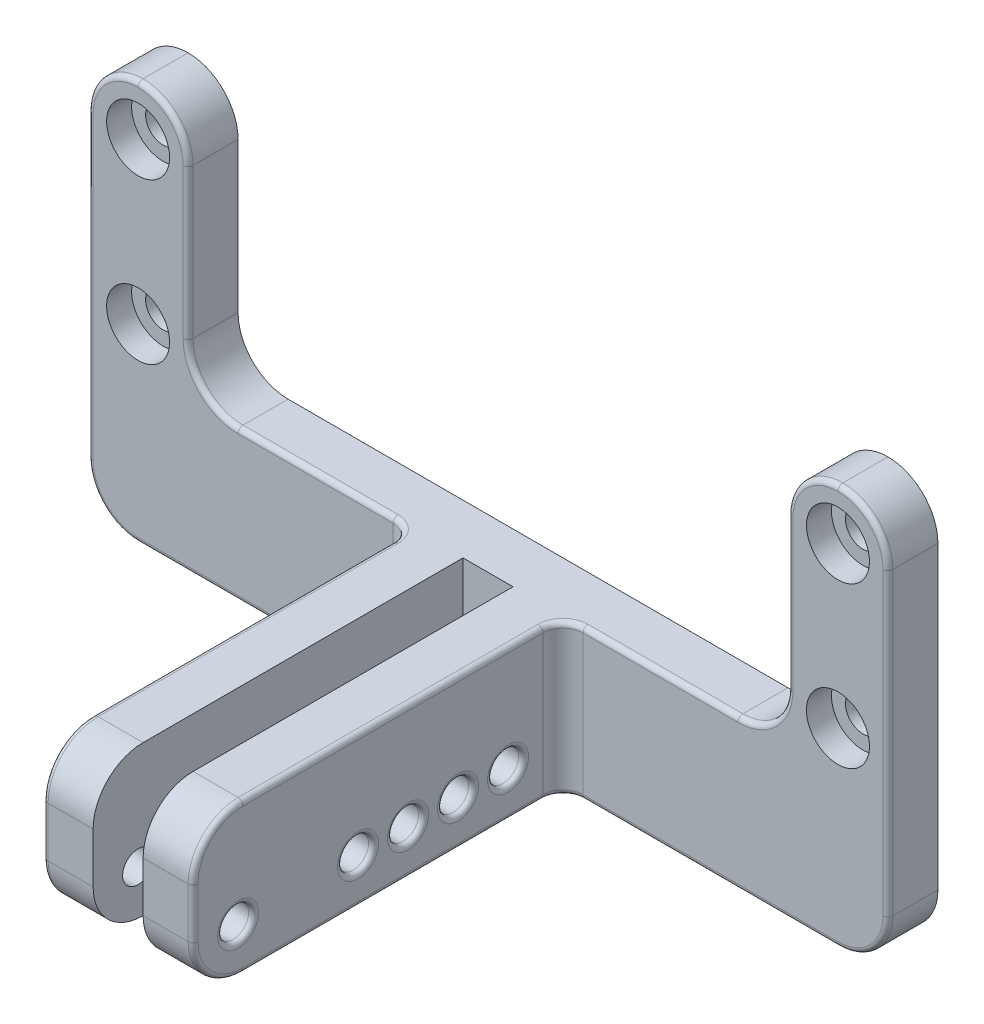
from build123d import *

# Parameters (mm, degrees)
SKETCH_1_W          = 80
SKETCH_1_H          = 40
EXTRUDE_1_DEPTH     = 5
SKETCH_2_R          = 1.75
CUT_EXTRUDE_1_DEPTH = 46
SKETCH_3_W          = 5
SKETCH_3_H          = 15
EXTRUDE_2_DEPTH     = 37
SKETCH_4_R          = 1.55
CUT_EXTRUDE_2_DEPTH = 67.484960705
SKETCH_5_W          = 60
SKETCH_5_H          = 25
CUT_EXTRUDE_3_DEPTH = 5
FILLET_1_R          = 5
FILLET_2_R          = 5
FILLET_3_R          = 2
FILLET_4_R          = 0.5
SKETCH_6_R          = 3.15
CUT_EXTRUDE_4_DEPTH = 2.5


with BuildPart() as part:
    # ｽｹｯﾁ1 → ﾎﾞｽ - 押し出し1 (new body)
    with BuildSketch(Plane.XY):
        Rectangle(SKETCH_1_W, SKETCH_1_H)
    extrude(amount=EXTRUDE_1_DEPTH)

    # ｽｹｯﾁ2 → ｶｯﾄ - 押し出し1 (cut, through all)
    with BuildSketch(Plane.XY):
        with Locations((35, 15)):
            Circle(SKETCH_2_R)
        with Locations((35, -1)):
            Circle(SKETCH_2_R)
        with Locations(Location((-35, 15, 0), (0, 0, 180))):
            Circle(SKETCH_2_R)
        with Locations(Location((-35, -1, 0), (0, 0, 180))):
            Circle(SKETCH_2_R)
    extrude(amount=CUT_EXTRUDE_1_DEPTH, mode=Mode.SUBTRACT)

    # ｽｹｯﾁ3 → ﾎﾞｽ - 押し出し2 (add)
    with BuildSketch(Plane.XY.offset(5)):
        with Locations((5, -12.5)):
            Rectangle(SKETCH_3_W, SKETCH_3_H)
        with Locations((-5, -12.5)):
            Rectangle(SKETCH_3_W, SKETCH_3_H)
    extrude(amount=EXTRUDE_2_DEPTH)

    # ｽｹｯﾁ4 → ｶｯﾄ - 押し出し2 (cut, through all)
    with BuildSketch(Plane.ZY.offset(7.5)):
        with Locations(Location((10.5, -15.5, 0), (0, 0, 90))):
            Circle(SKETCH_4_R)
        with Locations(Location((37.5, -15.5, 0), (0, 0, 90))):
            Circle(SKETCH_4_R)
        with Locations(Location((15.5, -15.5, 0), (0, 0, 90))):
            Circle(SKETCH_4_R)
        with Locations(Location((20.5, -15.5, 0), (0, 0, 90))):
            Circle(SKETCH_4_R)
        with Locations(Location((25.5, -15.5, 0), (0, 0, 90))):
            Circle(SKETCH_4_R)
    extrude(amount=-CUT_EXTRUDE_2_DEPTH, mode=Mode.SUBTRACT)

    # ｽｹｯﾁ5 → ｶｯﾄ - 押し出し3 (cut)
    with BuildSketch(Plane.XY):
        with Locations((0, 7.5)):
            Rectangle(SKETCH_5_W, SKETCH_5_H)
    extrude(amount=CUT_EXTRUDE_3_DEPTH, mode=Mode.SUBTRACT)

    # ﾌｨﾚｯﾄ1
    fillet_1_edges = [part.edges().sort_by_distance(p)[0] for p in [
        (5, -5, 42),
        (-5, -5, 42),
        (5, -20, 42),
        (-5, -20, 42),
    ]]
    fillet(fillet_1_edges, radius=FILLET_1_R)

    # ﾌｨﾚｯﾄ2
    fillet_2_edges = [part.edges().sort_by_distance(p)[0] for p in [
        (-30, -5, 2.5),
        (30, -5, 2.5),
        (30, 20, 2.5),
        (40, 20, 2.5),
        (40, -20, 2.5),
        (-40, -20, 2.5),
        (-30, 20, 2.5),
        (-40, 20, 2.5),
    ]]
    fillet(fillet_2_edges, radius=FILLET_2_R - 0.0001)  # a hair under: the kernel refuses the full size

    # ﾌｨﾚｯﾄ3
    fillet_3_edges = [part.edges().sort_by_distance(p)[0] for p in [
        (7.5, -12.5, 5),
        (-7.5, -12.5, 5),
    ]]
    fillet(fillet_3_edges, radius=FILLET_3_R)

    # ﾌｨﾚｯﾄ4
    fillet_4_edges = [part.edges().sort_by_distance(p)[0] for p in [
        (7.5, -12.5, 42),
        (7.5, -5, 22),
        (-7.5, -5, 22),
        (7.5, -20, 22),
        (7.5, -18.535533906, 40.535533906),
        (7.5, -6.464466094, 40.535533906),
        (-7.5, -12.5, 42),
        (-7.5, -20, 22),
        (-7.5, -18.535533906, 40.535533906),
        (-7.5, -6.464466094, 40.535533906),
        (-30, 7.5, 5),
        (-17.25005, -5, 5),
        (30, 7.5, 5),
        (40, 0, 5),
        (38.535563195, -18.535563195, 5),
        (38.535563195, 18.535563195, 5),
        (31.464436805, 18.535563195, 5),
        (-22.25005, -20, 5),
        (-40, 0, 5),
        (-38.535563195, 18.535563195, 5),
        (-31.464436805, 18.535563195, 5),
        (-38.535563195, -18.535563195, 5),
        (-28.535563195, -3.535563195, 5),
        (28.535563195, -3.535563195, 5),
        (17.25005, -5, 5),
        (22.25005, -20, 5),
        (8.085786438, -5, 5.585786438),
        (8.085786438, -20, 5.585786438),
        (-8.085786438, -20, 5.585786438),
        (-8.085786438, -5, 5.585786438),
        (7.5, -17.05, 10.5),
        (-7.5, -17.05, 10.5),
        (7.5, -17.05, 37.5),
        (-7.5, -17.05, 37.5),
        (7.5, -17.05, 15.5),
        (-7.5, -17.05, 15.5),
        (7.5, -17.05, 20.5),
        (-7.5, -17.05, 20.5),
        (7.5, -17.05, 25.5),
        (-7.5, -17.05, 25.5),
    ]]
    fillet(fillet_4_edges, radius=FILLET_4_R)

    # ｽｹｯﾁ6 → ｶｯﾄ - 押し出し4 (cut)
    with BuildSketch(Plane.XY.offset(5)):
        with Locations((-35, 15)):
            Circle(SKETCH_6_R)
        with Locations((-35, -1)):
            Circle(SKETCH_6_R)
        with Locations(Location((35, -1, 0), (0, 0, 180))):
            Circle(SKETCH_6_R)
        with Locations(Location((35, 15, 0), (0, 0, 180))):
            Circle(SKETCH_6_R)
    extrude(amount=-CUT_EXTRUDE_4_DEPTH, mode=Mode.SUBTRACT)


solid = part.part
